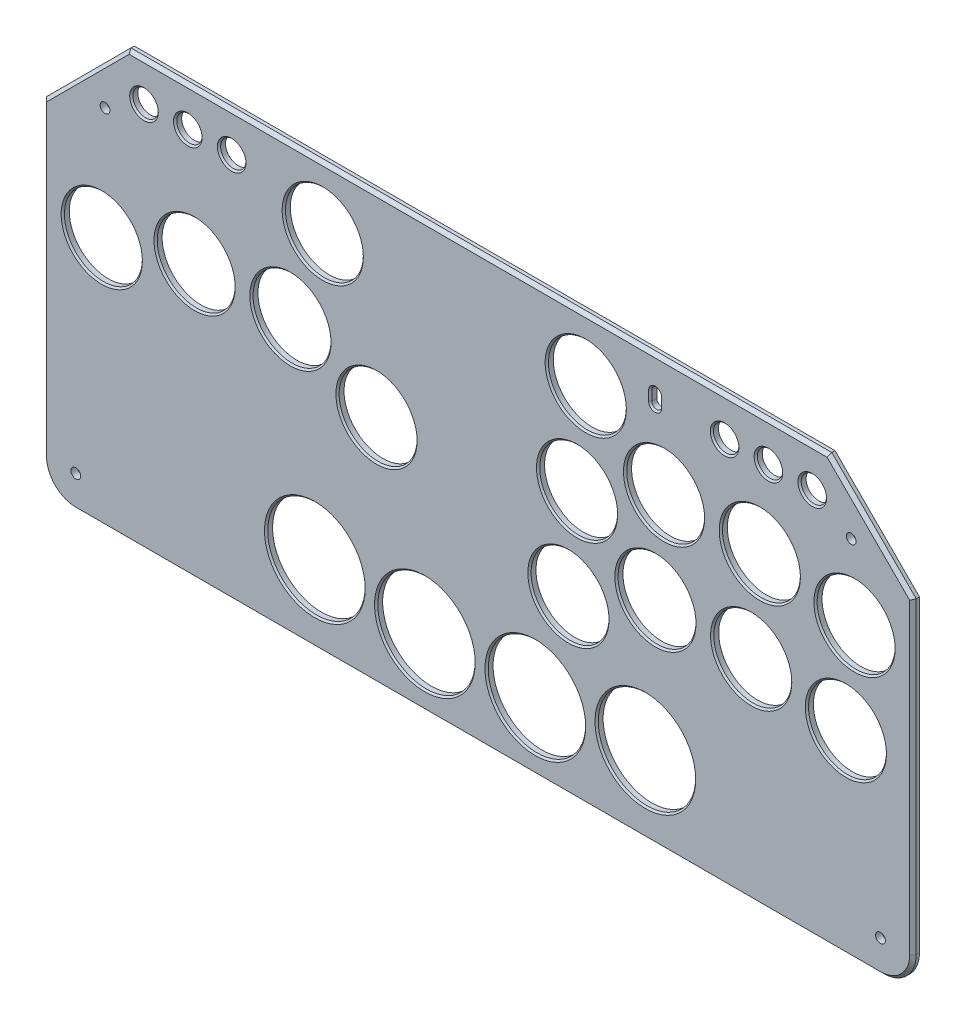
from build123d import *

# Parameters (mm, degrees)
BOSS_EXTRUDE1_DEPTH   = 2
SKETCH24_R            = 3.9
CUT_EXTRUDE2_DEPTH    = 307.159370556
SKETCH1_R             = 12
SKETCH1_R_2           = 15
CUT_EXTRUDE3_DEPTH    = 307.159370556
F_3_0MM_DOWEL_HOLE1_D = 3
CHAMFER1_SIZE         = 1
CHAMFER2_SIZE         = 0.5


with BuildPart() as part:
    # Sketch2 → Boss-Extrude1 (new body)
    with BuildSketch(Plane.XY):
        with BuildLine():
            Line((6.41186441, 110.238694526), (6.41186441, 15.286374556))
            ThreePointArc((6.41186441, 15.286374556), (9.340796598, 8.215306744), (16.41186441, 5.286374556))
            Line((16.41186441, 5.286374556), (264.168886442, 5.286374556))
            ThreePointArc((264.168886442, 5.286374556), (271.239954254, 8.215306744), (274.168886442, 15.286374556))
            Line((274.168886442, 15.286374556), (274.168886442, 110.238694526))
            Line((274.168886442, 110.238694526), (248.168886442, 136.238694526))
            Line((248.168886442, 136.238694526), (32.41186441, 136.238694526))
            Line((32.41186441, 136.238694526), (6.41186441, 110.238694526))
        make_face()
    extrude(amount=-BOSS_EXTRUDE1_DEPTH)

    # Sketch24 → Cut-Extrude2 (cut, through all)
    with BuildSketch(Plane.XY):
        with Locations((37.41186441, 124.238694526)):
            Circle(SKETCH24_R)
        with Locations((50.91186441, 124.238694526)):
            Circle(SKETCH24_R)
        with Locations((64.41186441, 124.238694526)):
            Circle(SKETCH24_R)
        with Locations((216.168886442, 124.238694526)):
            Circle(SKETCH24_R)
        with Locations((229.668886442, 124.238694526)):
            Circle(SKETCH24_R)
        with Locations((243.168886442, 124.238694526)):
            Circle(SKETCH24_R)
        with BuildLine():
            Line((193.298949614, 125.738694526), (193.298949614, 122.738694526))
            ThreePointArc((193.298949614, 122.738694526), (194.798949614, 121.238694526), (196.298949614, 122.738694526))
            Line((196.298949614, 122.738694526), (196.298949614, 125.738694526))
            ThreePointArc((196.298949614, 125.738694526), (194.798949614, 127.238694526), (193.298949614, 125.738694526))
        make_face()
    extrude(amount=-CUT_EXTRUDE2_DEPTH, mode=Mode.SUBTRACT)

    # Sketch1 → Cut-Extrude3 (cut, through all)
    with BuildSketch(Plane.XY):
        with Locations((24.41186441, 82.179064133)):
            Circle(SKETCH1_R)
        with Locations((52.996556322, 89.470524089)):
            Circle(SKETCH1_R)
        with Locations((92.45540719, 117.238694526)):
            Circle(SKETCH1_R)
        with Locations((82.496556322, 89.470524089)):
            Circle(SKETCH1_R)
        with Locations((109.001946024, 76.520067852)):
            Circle(SKETCH1_R)
        with Locations((168.091946024, 58.360067852)):
            Circle(SKETCH1_R)
        with Locations((194.873540874, 70.729230202)):
            Circle(SKETCH1_R)
        with Locations((224.358659158, 69.792320505)):
            Circle(SKETCH1_R)
        with Locations((253.510608286, 65.274150291)):
            Circle(SKETCH1_R)
        with Locations((256.168886442, 94.654135948)):
            Circle(SKETCH1_R)
        with Locations((227.016937315, 99.172306162)):
            Circle(SKETCH1_R)
        with Locations((197.531819031, 100.10921586)):
            Circle(SKETCH1_R)
        with Locations((170.75022418, 87.740053509)):
            Circle(SKETCH1_R)
        with Locations((191.774681199, 29.091460603)):
            Circle(SKETCH1_R_2)
        with Locations((157.891946024, 26.270067852)):
            Circle(SKETCH1_R_2)
        with Locations((123.891946024, 26.270067852)):
            Circle(SKETCH1_R_2)
        with Locations((90.009210849, 29.091460603)):
            Circle(SKETCH1_R_2)
        with Locations((173.429012786, 117.118176179)):
            Circle(SKETCH1_R)
    extrude(amount=-CUT_EXTRUDE3_DEPTH, mode=Mode.SUBTRACT)

    # Ø3.0mm Dowel Hole1 (through all)
    with Locations(Plane.XY):
        with Locations((25.42227205, 117.228286886), (16.41186441, 15.286374556), (264.168886442, 15.286374556), (255.158478802, 117.228286886)):
            Hole(F_3_0MM_DOWEL_HOLE1_D / 2)

    # Chamfer1
    chamfer1_edges = [part.edges().sort_by_distance(p)[0] for p in [
        (274.168886442, 62.762534541, 0),
        (271.239954254, 8.215306744, 0),
        (140.290375426, 5.286374556, 0),
        (9.340796598, 8.215306744, 0),
        (261.168886442, 123.238694526, 0),
        (140.290375426, 136.238694526, 0),
        (6.41186441, 62.762534541, 0),
        (19.41186441, 123.238694526, 0),
    ]]
    chamfer(chamfer1_edges, length=CHAMFER1_SIZE)

    # Chamfer2
    chamfer2_edges = [part.edges().sort_by_distance(p)[0] for p in [
        (239.268886442, 124.238694526, 0),
        (225.768886442, 124.238694526, 0),
        (212.268886442, 124.238694526, 0),
        (193.298949614, 124.238694526, 0),
        (194.798949614, 121.238694526, 0),
        (194.798949614, 127.238694526, 0),
        (196.298949614, 124.238694526, 0),
        (60.51186441, 124.238694526, 0),
        (47.01186441, 124.238694526, 0),
        (33.51186441, 124.238694526, 0),
        (161.429012786, 117.118176179, 0),
        (244.168886442, 94.654135948, 0),
        (215.016937315, 99.172306162, 0),
        (185.531819031, 100.10921586, 0),
        (158.75022418, 87.740053509, 0),
        (182.873540874, 70.729230202, 0),
        (212.358659158, 69.792320505, 0),
        (241.510608286, 65.274150291, 0),
        (176.774681199, 29.091460603, 0),
        (156.091946024, 58.360067852, 0),
        (142.891946024, 26.270067852, 0),
        (108.891946024, 26.270067852, 0),
        (97.001946024, 76.520067852, 0),
        (75.009210849, 29.091460603, 0),
        (80.45540719, 117.238694526, 0),
        (70.496556322, 89.470524089, 0),
        (40.996556322, 89.470524089, 0),
        (12.41186441, 82.179064133, 0),
    ]]
    chamfer(chamfer2_edges, length=CHAMFER2_SIZE)


solid = part.part
